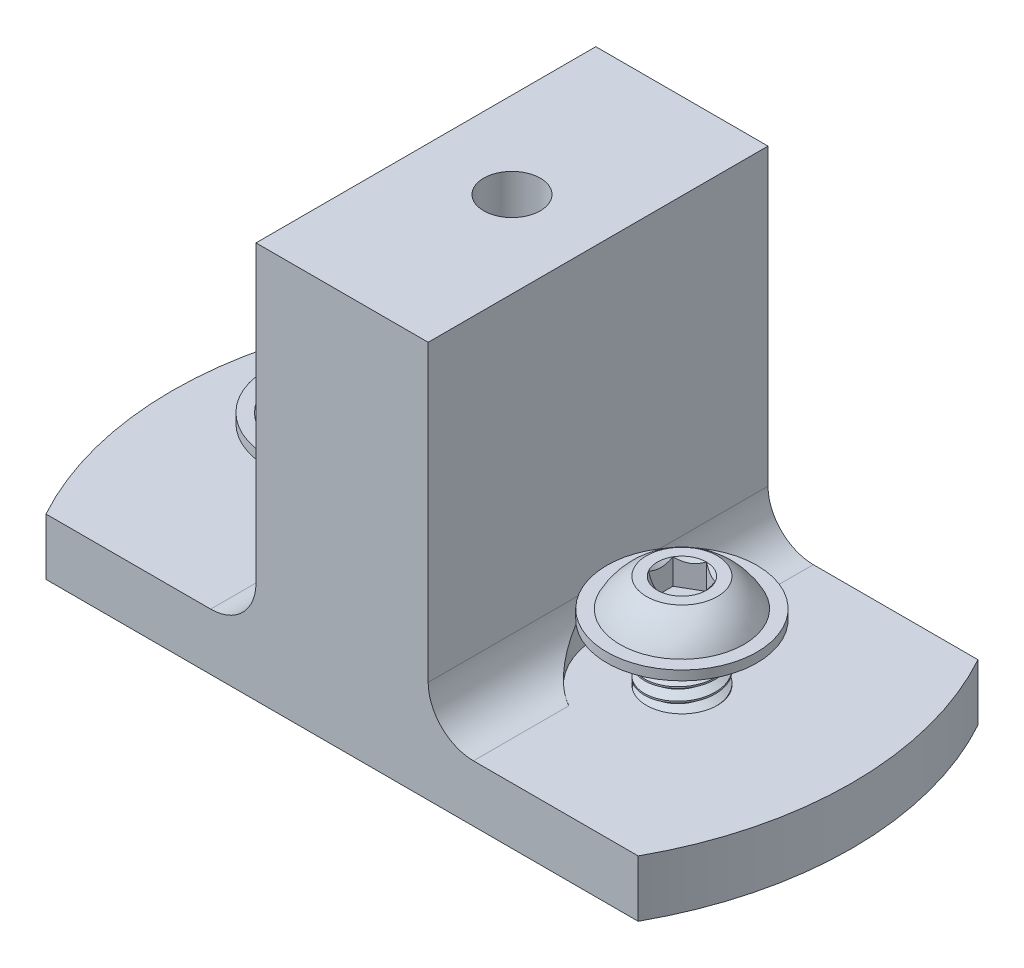
from build123d import *

# Parameters (mm, degrees)
SKETCH1_R           = 3.96875
BOSS_EXTRUDE1_DEPTH = 17.4625
CUT_SWEEP1_PITCH    = 1.411111111
SKETCH4_OUTSIDE_W   = 16.912
SKETCH4_OUTSIDE_H   = 16.912
SKETCH4_OUTSIDE_R   = 2.899449189
CUT_EXTRUDE1_DEPTH  = 1.411111111
CUT_EXTRUDE1_DRAFT  = -45
CUT_EXTRUDE2_DEPTH  = 2.8575
BOSS_EXTRUDE2_START = -6.35
SKETCH8_R           = 3.96875
BOSS_EXTRUDE2_DEPTH = 6.35
BOSS_EXTRUDE7_DEPTH = 38.1
SKETCH16_R          = 3.175
CUT_EXTRUDE5_DEPTH  = 66.087500076
CUT_EXTRUDE6_DEPTH  = 8.89
FILLET1_R           = 5.08
SKETCH20_R          = 9.398
CUT_EXTRUDE7_DEPTH  = 12.7


with BuildPart() as part:
    # Sketch1 → Boss-Extrude1 (new body)
    with BuildSketch(Plane(origin=(0, 0, 0), x_dir=(1, 0, 0), z_dir=(0, 1, 0))):
        with Locations(Location((-19.05, 0, 0), (0, 0, 270))):
            Circle(SKETCH1_R)
    extrude(amount=-BOSS_EXTRUDE1_DEPTH)

    # Cut-Sweep1: the profile of Sketch3 screwed along a right-hand helix of 13.375 turns, 8 arcs to a turn; built about Z, then put on its axis
    cut_sweep1_z = Axis((0, 0, 0), (0, 0, 1))
    cut_sweep1_corners = [(3.052206448, 0, -0.529166667), (4.045128629, 0, 0.044097222), (4.045128629, 0, -1.278819444), (3.052206448, 0, -0.705555556)]
    with BuildLine(mode=Mode.PRIVATE) as cut_sweep1_profile:
        Line(cut_sweep1_corners[0], cut_sweep1_corners[1])
        Line(cut_sweep1_corners[1], cut_sweep1_corners[2])
        Line(cut_sweep1_corners[2], cut_sweep1_corners[3])
        Line(cut_sweep1_corners[3], cut_sweep1_corners[0])
    cut_sweep1_cap = Face(cut_sweep1_profile.wire())
    cut_sweep1_turn_angles = [0, 22.5, 45, 67.5, 90, 112.5, 135, 157.5, 180, 202.5, 225, 247.5, 270, 292.5, 315, 337.5, 360]
    cut_sweep1_turn_weights = [1, 0.9238795325112867, 1, 0.9238795325112867, 1, 0.9238795325112867, 1, 0.9238795325112867, 1, 0.9238795325112867, 1, 0.9238795325112867, 1, 0.9238795325112867, 1, 0.9238795325112867, 1]
    cut_sweep1_turn_rails = [Edge.make_bspline([Vector(p[0], p[1], 0).rotate(cut_sweep1_z, cut_sweep1_turn_angles[k]) / cut_sweep1_turn_weights[k] + Vector(0, 0, p[2] + CUT_SWEEP1_PITCH * cut_sweep1_turn_angles[k] / 360) for k in range(17)], [0, 0, 0, 1, 1, 2, 2, 3, 3, 4, 4, 5, 5, 6, 6, 7, 7, 8, 8, 8], 2, cut_sweep1_turn_weights) for p in cut_sweep1_corners]
    cut_sweep1_turn_sides = [Face.make_surface_from_curves(cut_sweep1_turn_rails[p[0]], cut_sweep1_turn_rails[p[1]]) for p in [(0, 1), (1, 2), (2, 3), (3, 0)]]
    cut_sweep1_last_angles = [4680, 4702.5, 4725, 4747.5, 4770, 4792.5, 4815]
    cut_sweep1_last_weights = [1, 0.9238795325112867, 1, 0.9238795325112867, 1, 0.9238795325112594, 1]
    cut_sweep1_last_rails = [Edge.make_bspline([Vector(p[0], p[1], 0).rotate(cut_sweep1_z, cut_sweep1_last_angles[k]) / cut_sweep1_last_weights[k] + Vector(0, 0, p[2] + CUT_SWEEP1_PITCH * cut_sweep1_last_angles[k] / 360) for k in range(7)], [0, 0, 0, 1, 1, 2, 2, 3, 3, 3], 2, cut_sweep1_last_weights) for p in cut_sweep1_corners]
    cut_sweep1_last_sides = [Face.make_surface_from_curves(cut_sweep1_last_rails[p[0]], cut_sweep1_last_rails[p[1]]) for p in [(0, 1), (1, 2), (2, 3), (3, 0)]]
    cut_sweep1 = Plane(origin=(-19.05, -17.4625, 0), x_dir=(0, 0, -1), z_dir=(0, 1, 0)) * Solid(Shell([*[p.moved(Location((0, 0, CUT_SWEEP1_PITCH * i))) for i in range(13) for p in cut_sweep1_turn_sides], *cut_sweep1_last_sides, cut_sweep1_cap, cut_sweep1_cap.rotate(cut_sweep1_z, 4815).moved(Location((0, 0, CUT_SWEEP1_PITCH * 4815 / 360)))]))
    add(cut_sweep1, mode=Mode.SUBTRACT)


with BuildPart() as cut_extrude1_tool:
    # Sketch4 outside → Cut-Extrude1 (with draft: the straight prism first)
    with BuildSketch(Plane.XZ.offset(17.4625)):
        with Locations((-19.05, 0)):
            Rectangle(SKETCH4_OUTSIDE_W, SKETCH4_OUTSIDE_H)
        with Locations((-19.05, 0)):
            Circle(SKETCH4_OUTSIDE_R, mode=Mode.SUBTRACT)
    extrude(amount=-CUT_EXTRUDE1_DEPTH)
    # Cut-Extrude1: the draft: its side faces are tilted about the plane it starts from
    cut_extrude1_sides = [cut_extrude1_tool.faces().sort_by_distance(p)[0] for p in [
        (-19.05, -16.756944444, -8.456),
        (-10.594, -16.756944444, 0),
        (-19.05, -16.756944444, 8.456),
        (-27.506, -16.756944444, 0),
        (-21.949449189, -16.756944444, 0),
    ]]
    draft(cut_extrude1_sides, Plane.XZ.offset(17.4625), CUT_EXTRUDE1_DRAFT)


with BuildPart() as part_1:
    add(part.part)

    # Cut-Extrude1: cut by cut_extrude1_tool
    add(cut_extrude1_tool.part, mode=Mode.SUBTRACT)

    # Sketch5 → Revolve1 (revolve)
    with BuildSketch(Plane.XY, mode=Mode.PRIVATE) as revolve1_sk:
        with BuildLine():
            Line((-19.05, 0), (-19.05, 4.2164))
            Line((-19.05, 4.2164), (-23.01875, 4.2164))
            ThreePointArc((-23.01875, 4.2164), (-24.732243312, 2.846599775), (-25.9969, 1.0541))
            Line((-25.9969, 1.0541), (-27.4701, 1.0541))
            Line((-27.4701, 1.0541), (-27.4701, 0))
            Line((-27.4701, 0), (-19.05, 0))
        make_face()
    revolve(revolve1_sk.sketch.rotate(Axis((-19.05, 0, 0), (0, 1, 0)), 270), axis=Axis((-19.05, 0, 0), (0, 1, 0)))

    # Sketch6 → Cut-Extrude2 (cut)
    with BuildSketch(Plane(origin=(0, 4.2164, 0), x_dir=(1, 0, 0), z_dir=(0, 1, 0))):
        Polygon((-19.05, 2.749630657), (-21.43125, 1.374815329), (-21.43125, -1.374815329), (-19.05, -2.749630657), (-16.66875, -1.374815329), (-16.66875, 1.374815329), align=None)
    extrude(amount=-CUT_EXTRUDE2_DEPTH, mode=Mode.SUBTRACT)

    # Cut-Extrude3 cone 1 section (through the dimple's axis) → Cut-Extrude3 (revolve, cut)
    with BuildSketch(Plane(origin=(-19.05, 4.2164, 0), x_dir=(0, 0, 1), z_dir=(1, 0, 0))):
        Polygon((0, 0), (2.749630657, 0), (0, 2.749630657), align=None)
    revolve(axis=Axis((-19.05, 4.2164, 0), (0, -1, 0)), mode=Mode.SUBTRACT)


with BuildPart() as body_2:
    # Body-Move/Copy1: copy of part
    add(part_1.part.moved(Location((38.1, 0, 0))))


with BuildPart() as body_3:
    # Sketch8 → Boss-Extrude2 (new body)
    with BuildSketch(Plane(origin=(0, 0, 0), x_dir=(1, 0, 0), z_dir=(0, 1, 0)).offset(BOSS_EXTRUDE2_START)):
        with BuildLine():
            Line((-33.19559728, 19.05), (33.19559728, 19.05))
            ThreePointArc((33.19559728, 19.05), (38.1, 0), (33.19559728, -19.05))
            Line((33.19559728, -19.05), (-33.19559728, -19.05))
            ThreePointArc((-33.19559728, -19.05), (-38.1, 0), (-33.19559728, 19.05))
        make_face()
        with Locations(Location((19.05, 0, 0), (0, 0, 270))):
            Circle(SKETCH8_R, mode=Mode.SUBTRACT)
        with Locations(Location((-19.05, 0, 0), (0, 0, 270))):
            Circle(SKETCH8_R, mode=Mode.SUBTRACT)
    extrude(amount=-BOSS_EXTRUDE2_DEPTH)

    # Sketch15 → Boss-Extrude7 (add)
    with BuildSketch(Plane(origin=(0, -6.35, 0), x_dir=(1, 0, 0), z_dir=(0, 1, 0))):
        Polygon((0, 19.05), (-9.652, 19.05), (-9.652, -19.05), (9.652, -19.05), (9.652, 19.05), align=None)
    extrude(amount=BOSS_EXTRUDE7_DEPTH)

    # Sketch16 → Cut-Extrude5 (cut, through all)
    with BuildSketch(Plane(origin=(0, 31.75, 0), x_dir=(1, 0, 0), z_dir=(0, 1, 0))):
        with Locations(Location((0, 0, 0), (0, 0, 270))):
            Circle(SKETCH16_R)
    extrude(amount=-CUT_EXTRUDE5_DEPTH, mode=Mode.SUBTRACT)

    # Sketch19 → Cut-Extrude6 (cut)
    with BuildSketch(Plane.XZ.offset(12.7)):
        Polygon((0, 6.604), (-5.719231767, 3.302), (-5.719231767, -3.302), (0, -6.604), (5.719231767, -3.302), (5.719231767, 3.302), align=None)
    extrude(amount=-CUT_EXTRUDE6_DEPTH, mode=Mode.SUBTRACT)

    # Fillet1
    fillet1_edges = [body_3.edges().sort_by_distance(p)[0] for p in [
        (-9.652, -6.35, 0),
        (9.652, -6.35, 0),
    ]]
    fillet(fillet1_edges, radius=FILLET1_R)

    # Sketch20 → Cut-Extrude7 (cut)
    with BuildSketch(Plane(origin=(0, -6.35, 0), x_dir=(1, 0, 0), z_dir=(0, 1, 0))):
        with Locations((19.05, 0)):
            Circle(SKETCH20_R)
        with Locations((-19.05, 0)):
            Circle(SKETCH20_R)
    extrude(amount=CUT_EXTRUDE7_DEPTH, mode=Mode.SUBTRACT)


solid = Compound([part_1.part, body_2.part, body_3.part])
